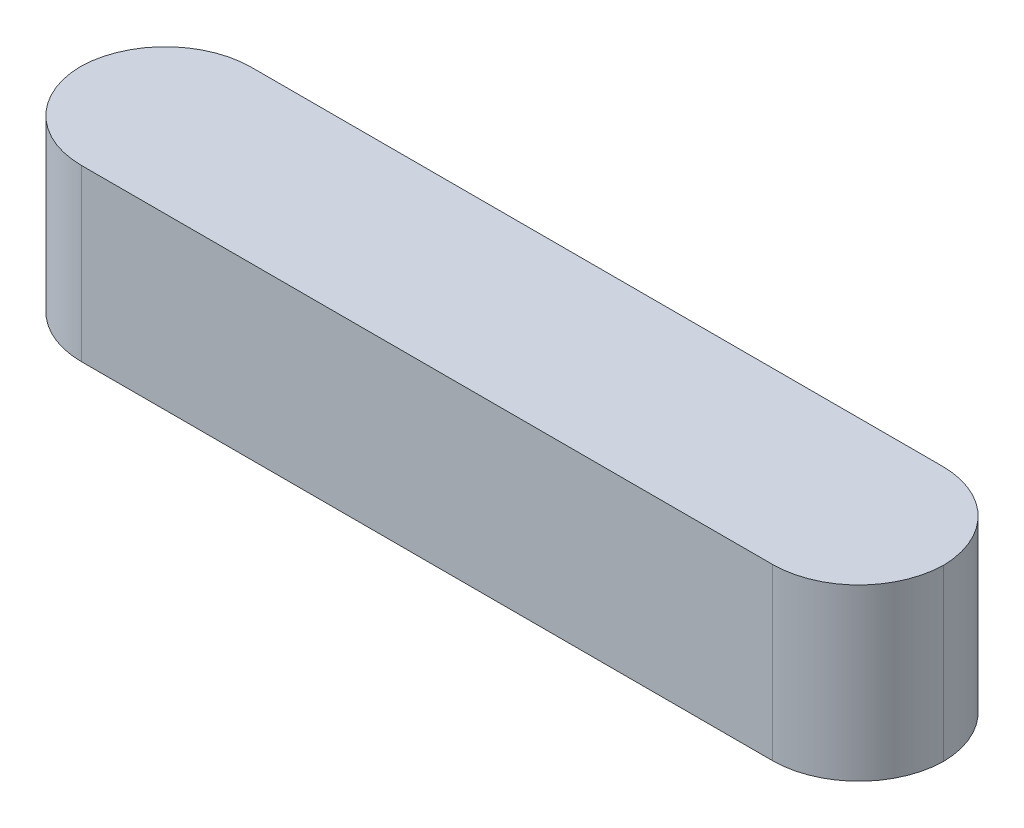
from build123d import *

# Parameters (mm, degrees)
SKETCH1_W           = 25.4
SKETCH1_H           = 5
BOSS_EXTRUDE1_DEPTH = 5
FILLET1_R           = 2.54


with BuildPart() as part:
    # Sketch1 → Boss-Extrude1 (new body)
    with BuildSketch(Plane(origin=(0, 0, 0), x_dir=(1, 0, 0), z_dir=(0, 1, 0))):
        with Locations((12.7, -2.5)):
            Rectangle(SKETCH1_W, SKETCH1_H)
    extrude(amount=BOSS_EXTRUDE1_DEPTH)

    # Fillet1
    # the kernel refuses this fillet: 2.54 mm, written as the material it takes off along each edge
    with BuildSketch(Plane(origin=(0, -6.35, 5), x_dir=(1, 0, 0), z_dir=(0, 1, 0)), Plane(origin=(25.4, -6.35, 0), x_dir=(-1, 0, 0), z_dir=(0, 1, 0)), Plane(origin=(25.4, -6.35, 5), x_dir=(0, 0, -1), z_dir=(0, 1, 0))) as fillet1_piece_1:
        with BuildLine():
            CenterArc((FILLET1_R, FILLET1_R), FILLET1_R, 180, 90)
            Line((0, FILLET1_R), (0, 0))
            Line((0, 0), (FILLET1_R, 0))
        make_face()
    extrude(amount=17.7, mode=Mode.SUBTRACT)
    with BuildSketch(Plane(origin=(0, -6.35, 0), x_dir=(1, 0, 0), z_dir=(0, 1, 0))) as fillet1_piece_2:
        with BuildLine():
            CenterArc((FILLET1_R, -FILLET1_R), FILLET1_R, 90, 90)
            Line((0, -FILLET1_R), (0, 0))
            Line((0, 0), (FILLET1_R, 0))
        make_face()
    extrude(amount=17.7, mode=Mode.SUBTRACT)


solid = part.part
